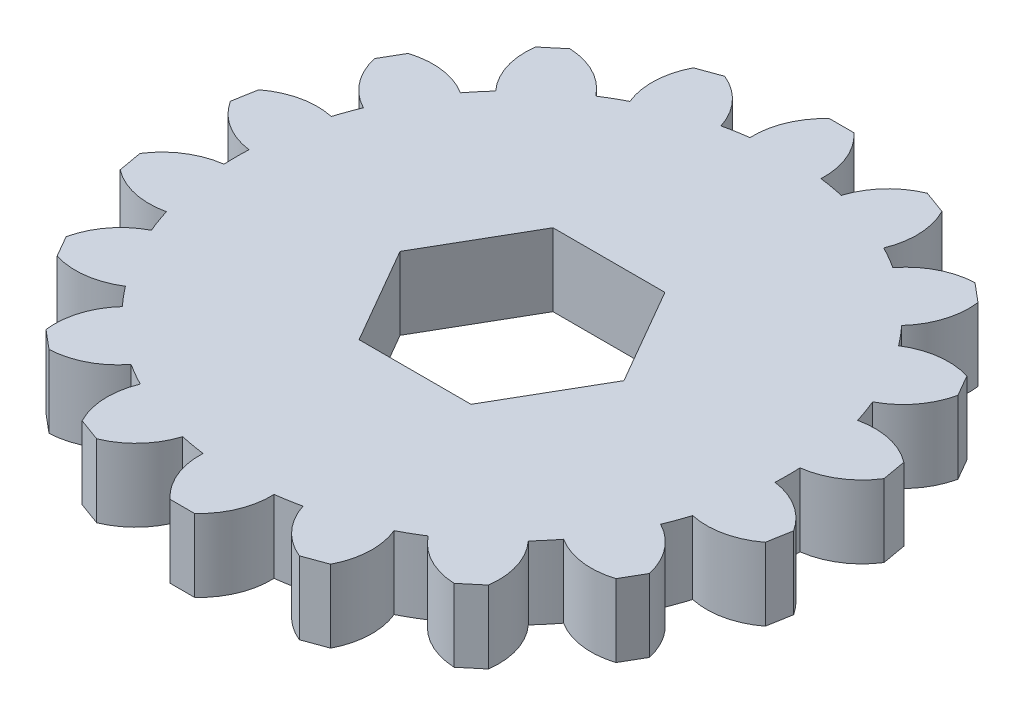
from build123d import *

# Parameters (mm, degrees)
SKETCH2_R           = 18.064125
BOSS_EXTRUDE2_DEPTH = 4.7625
BOSS_EXTRUDE3_DEPTH = 4.7625
CIRPATTERN1_COUNT   = 18


with BuildPart() as part:
    # Sketch2 → Boss-Extrude2 (new body)
    with BuildSketch(Plane(origin=(0, 0, 0), x_dir=(1, 0, 0), z_dir=(0, 1, 0))):
        Circle(SKETCH2_R)
        Polygon((7.332348419, 0), (3.666174209, 6.35), (-3.666174209, 6.35), (-7.332348419, 0), (-3.666174209, -6.35), (3.666174209, -6.35), align=None, mode=Mode.SUBTRACT)
    extrude(amount=BOSS_EXTRUDE2_DEPTH)

    # Sketch1 → Boss-Extrude3 (add)
    with BuildSketch(Plane(origin=(0, 0, 0), x_dir=(1, 0, 0), z_dir=(0, 1, 0))):
        with BuildLine():
            Line((0.801323931, 21.595965134), (-0.801323931, 21.595965134))
            ThreePointArc((-0.801323931, 21.595965134), (-1.972124229, 19.923889023), (-2.326579756, 17.913671836))
            ThreePointArc((-2.326579756, 17.913671836), (0, 18.064125), (2.326579756, 17.913671836))
            ThreePointArc((2.326579756, 17.913671836), (1.972124229, 19.923889023), (0.801323931, 21.595965134))
        make_face()
    boss_extrude3 = extrude(amount=BOSS_EXTRUDE3_DEPTH)

    # CirPattern1: Boss-Extrude3 ×18 about axis
    cirpattern1_axis = Axis((0, 4.7625, 0), (0, -1, 0))
    for i in range(1, CIRPATTERN1_COUNT):
        add(boss_extrude3.rotate(cirpattern1_axis, i * 360 / CIRPATTERN1_COUNT))


solid = part.part
